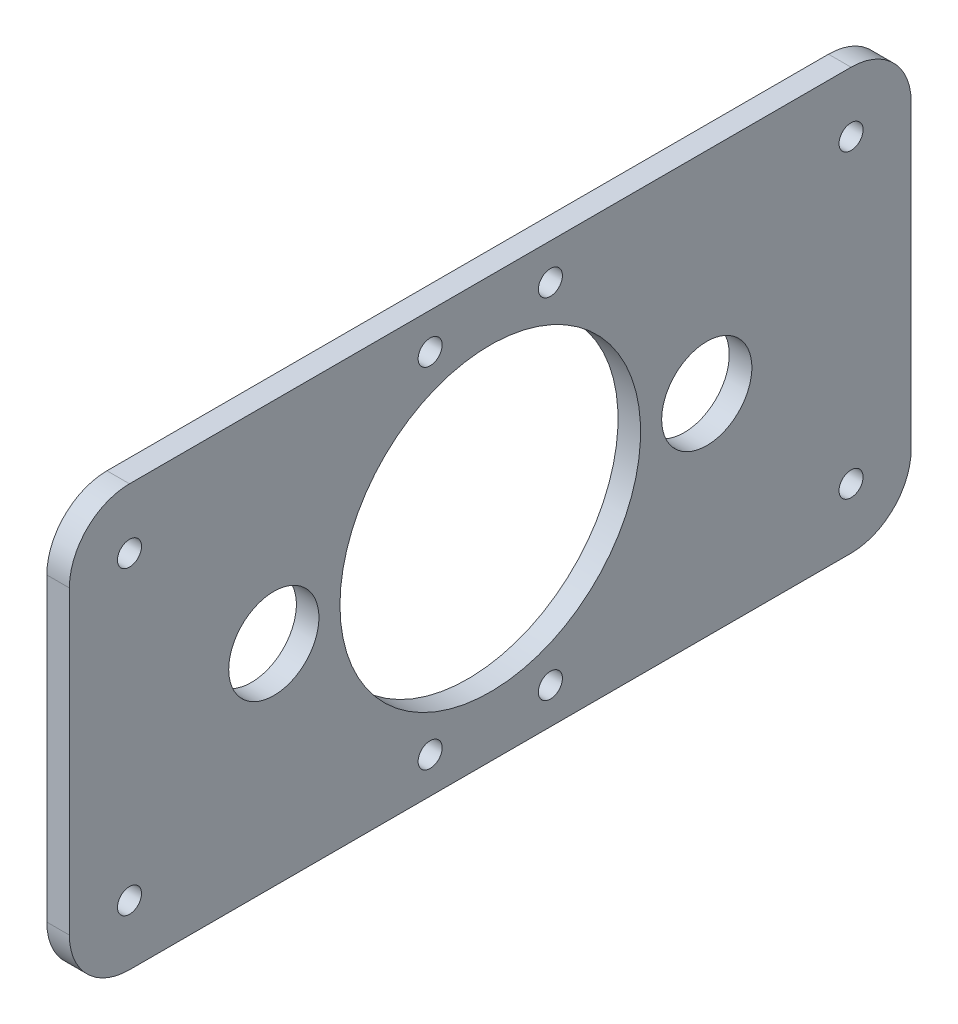
from build123d import *

# Parameters (mm, degrees)
SKETCH1_R           = 2.54
SKETCH1_R_2         = 31.75
SKETCH1_R_3         = 9.525
BOSS_EXTRUDE1_DEPTH = 4.7625


with BuildPart() as part:
    # Sketch1 → Boss-Extrude1 (new body)
    with BuildSketch(Plane(origin=(0, 0, 0), x_dir=(0, 0, -1), z_dir=(1, 0, 0))):
        with BuildLine():
            Line((226.734866781, 43.274288567), (226.734866781, 106.774288567))
            ThreePointArc((226.734866781, 106.774288567), (230.45461066, 115.754544688), (239.434866781, 119.474288567))
            Line((239.434866781, 119.474288567), (391.834866781, 119.474288567))
            ThreePointArc((391.834866781, 119.474288567), (400.815122902, 115.754544688), (404.534866781, 106.774288567))
            Line((404.534866781, 106.774288567), (404.534866781, 43.274288567))
            ThreePointArc((404.534866781, 43.274288567), (400.815122902, 34.294032445), (391.834866781, 30.574288567))
            Line((391.834866781, 30.574288567), (239.434866781, 30.574288567))
            ThreePointArc((239.434866781, 30.574288567), (230.45461066, 34.294032445), (226.734866781, 43.274288567))
        make_face()
        with Locations(Location((302.934866781, 111.854288567, 0), (0, 0, 180))):
            Circle(SKETCH1_R, mode=Mode.SUBTRACT)
        with Locations(Location((328.334866781, 111.854288567, 0), (0, 0, 180))):
            Circle(SKETCH1_R, mode=Mode.SUBTRACT)
        with Locations(Location((302.934866781, 38.194288567, 0), (0, 0, 180))):
            Circle(SKETCH1_R, mode=Mode.SUBTRACT)
        with Locations(Location((328.334866781, 38.194288567, 0), (0, 0, 180))):
            Circle(SKETCH1_R, mode=Mode.SUBTRACT)
        with Locations(Location((239.434866781, 43.274288567, 0), (0, 0, 180))):
            Circle(SKETCH1_R, mode=Mode.SUBTRACT)
        with Locations(Location((391.834866781, 43.274288567, 0), (0, 0, 180))):
            Circle(SKETCH1_R, mode=Mode.SUBTRACT)
        with Locations(Location((315.634866781, 75.024288567, 0), (0, 0, 180))):
            Circle(SKETCH1_R_2, mode=Mode.SUBTRACT)
        with Locations(Location((239.434866781, 106.774288567, 0), (0, 0, 180))):
            Circle(SKETCH1_R, mode=Mode.SUBTRACT)
        with Locations(Location((391.834866781, 106.774288567, 0), (0, 0, 180))):
            Circle(SKETCH1_R, mode=Mode.SUBTRACT)
        with Locations(Location((269.914866781, 75.024288567, 0), (0, 0, 180))):
            Circle(SKETCH1_R_3, mode=Mode.SUBTRACT)
        with Locations(Location((361.354866781, 75.024288567, 0), (0, 0, 180))):
            Circle(SKETCH1_R_3, mode=Mode.SUBTRACT)
    extrude(amount=BOSS_EXTRUDE1_DEPTH)


with BuildPart() as part_1:
    # Body-Move/Copy1: moved
    add(part.part.moved(Location((0, 0, 631.269733563))))


solid = part_1.part
